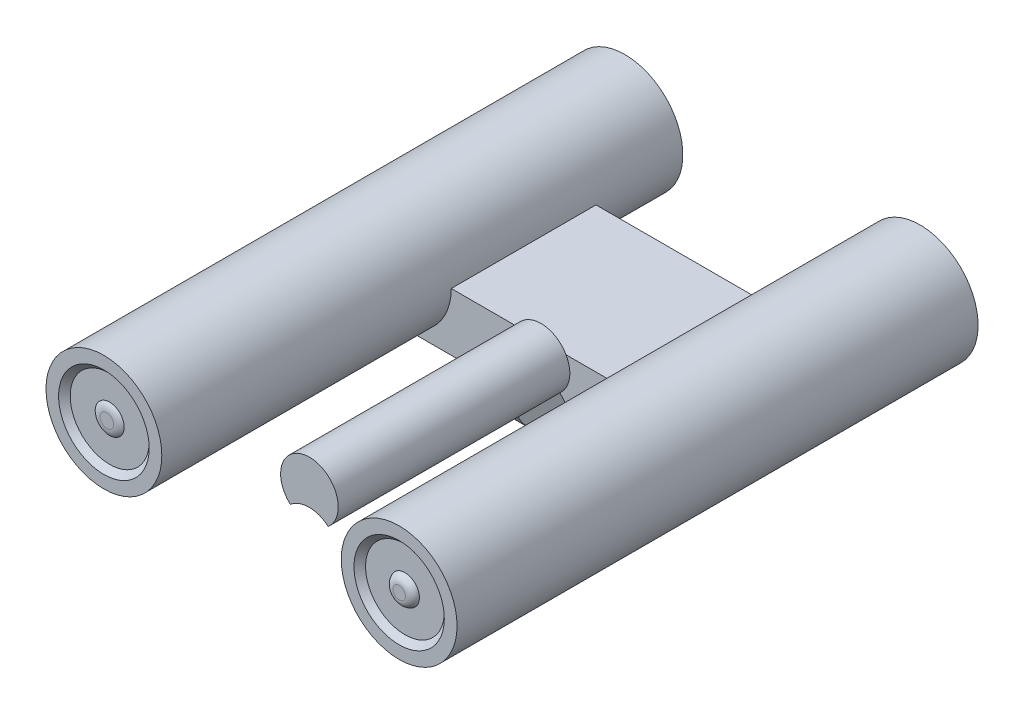
from build123d import *

# Parameters (mm, degrees)
BOSS_EXTRUDE1_DEPTH      = 50
SKETCH4_R                = 5
CUT_EXTRUDE1_DEPTH       = 116.323487875
FILLET2_R                = 20
SKETCH6_R                = 20
BOSS_EXTRUDE4_DEPTH      = 100
BOSS_EXTRUDE5_START      = 30
SKETCH7_R                = 20
BOSS_EXTRUDE5_DEPTH      = 30
SKETCH8_R                = 9.954491404
BOSS_EXTRUDE8_DEPTH      = 80
CUT_EXTRUDE2_DEPTH       = 130.001408198
CUT_EXTRUDE2_DEPTH_BACK  = 130.001408198
SKETCH9_R                = 13.643836255
CUT_EXTRUDE3_DEPTH       = 2
BOSS_EXTRUDE9_START      = 148
BOSS_EXTRUDE9_OUTLINE_R  = 5
BOSS_EXTRUDE9_DEPTH      = 1
CHAMFER1_SIZE            = 2
SKETCH11_R               = 13.6
CUT_EXTRUDE4_DEPTH       = 2
BOSS_EXTRUDE10_START     = 148
BOSS_EXTRUDE10_OUTLINE_R = 5
BOSS_EXTRUDE10_DEPTH     = 2
FILLET5_R                = 4
FILLET6_R                = 3
CHAMFER3_SIZE            = 2


# Read off the part's stored shape, not the designer's step: Boss-Extrude9, Boss-Extrude10
# Some blends are built 0.0001 mm under size
with BuildPart() as part:
    # Sketch1 → Boss-Extrude1 (new body)
    with BuildSketch(Plane.XY):
        with BuildLine():
            Line((-25.087834251, -19.995458795), (-10.087834251, -19.995458795))
            Line((-10.087834251, -19.995458795), (-10.087834251, 0.004541205))
            Line((-10.087834251, 0.004541205), (9.912165749, 0.004541205))
            Line((9.912165749, 0.004541205), (9.912165749, -19.995458795))
            Line((9.912165749, -19.995458795), (24.912165749, -19.995458795))
            Line((24.912165749, -19.995458795), (24.912165749, 0.004541205))
            Line((24.912165749, 0.004541205), (51, 0.004541205))
            ThreePointArc((51, 0.004541205), (65.142135624, 34.146676829), (31, 20.004541205))
            Line((31, 20.004541205), (-31, 20.004541205))
            ThreePointArc((-31, 20.004541205), (-65.142135624, 34.146676829), (-51, 0.004541205))
            Line((-51, 0.004541205), (-25.087834251, 0.004541205))
            Line((-25.087834251, 0.004541205), (-25.087834251, -19.995458795))
        make_face()
    extrude(amount=BOSS_EXTRUDE1_DEPTH)

    # Sketch4 → Cut-Extrude1 (cut, through all)
    with BuildSketch(Plane(origin=(24.912165749, 0, 0), x_dir=(0, 0, -1), z_dir=(1, 0, 0))):
        with Locations((-25, -9.995458795)):
            Circle(SKETCH4_R)
    extrude(amount=-CUT_EXTRUDE1_DEPTH, mode=Mode.SUBTRACT)

    # Fillet2
    fillet2_edges = [part.edges().sort_by_distance(p)[0] for p in [
        (-17.587834251, -19.995458795, 50),
        (-17.587834251, -19.995458795, 0),
        (17.412165749, -19.995458795, 0),
        (17.412165749, -19.995458795, 50),
    ]]
    fillet(fillet2_edges, radius=FILLET2_R)

    # Sketch6 → Boss-Extrude4 (add)
    with BuildSketch(Plane.XY.offset(50)):
        with Locations((-51, 20.004541205)):
            Circle(SKETCH6_R)
        with Locations(Location((51, 20.004541205, 0), (0, 0, 180))):
            Circle(SKETCH6_R)
    extrude(amount=BOSS_EXTRUDE4_DEPTH)

    # Sketch7 → Boss-Extrude5 (add)
    with BuildSketch(Plane(origin=(0, 0, 0), x_dir=(-1, 0, 0), z_dir=(0, 0, -1)).offset(BOSS_EXTRUDE5_START)):
        with Locations((-51, 20.004541205)):
            Circle(SKETCH7_R)
        with Locations((51, 20.004541205)):
            Circle(SKETCH7_R)
    extrude(amount=-BOSS_EXTRUDE5_DEPTH)

    # Sketch8 → Boss-Extrude8 (add)
    with BuildSketch(Plane.XY.offset(50)):
        with Locations(Location((0, 15.094063168, 0), (0, 0, 150.442767445))):
            Circle(SKETCH8_R)
    extrude(amount=BOSS_EXTRUDE8_DEPTH)

    # Sketch5 → Cut-Extrude2 (cut, two sides: drawn at the far end of the back side and taken through both)
    with BuildSketch(Plane.XY.offset(50).offset(-CUT_EXTRUDE2_DEPTH_BACK)):
        with BuildLine():
            Line((-10.087834251, 0.004541205), (9.912165749, 0.004541205))
            ThreePointArc((9.912165749, 0.004541205), (-0.087834251, 10.004541205), (-10.087834251, 0.004541205))
        make_face()
    extrude(amount=CUT_EXTRUDE2_DEPTH + CUT_EXTRUDE2_DEPTH_BACK, mode=Mode.SUBTRACT)

    # Sketch9 → Cut-Extrude3 (cut)
    with BuildSketch(Plane.XY.offset(150)):
        with Locations((-51, 20.004541205)):
            Circle(SKETCH9_R)
    extrude(amount=-CUT_EXTRUDE3_DEPTH, mode=Mode.SUBTRACT)

    # Boss-Extrude9 outline → Boss-Extrude9 (add)
    with BuildSketch(Plane.XY.offset(BOSS_EXTRUDE9_START)):
        with Locations((-51, 20.004541205)):
            Circle(BOSS_EXTRUDE9_OUTLINE_R)
    extrude(amount=BOSS_EXTRUDE9_DEPTH)

    # Chamfer1
    chamfer1_edges = [part.edges().sort_by_distance(p)[0] for p in [
        (-64.643836255, 20.004541205, 150),
    ]]
    chamfer(chamfer1_edges, length=CHAMFER1_SIZE - 0.0001)  # a hair under: the kernel refuses the full size

    # Sketch11 → Cut-Extrude4 (cut)
    with BuildSketch(Plane.XY.offset(150)):
        with Locations((51, 20.004541205)):
            Circle(SKETCH11_R)
    extrude(amount=-CUT_EXTRUDE4_DEPTH, mode=Mode.SUBTRACT)

    # Boss-Extrude10 outline → Boss-Extrude10 (add)
    with BuildSketch(Plane.XY.offset(BOSS_EXTRUDE10_START)):
        with Locations((51, 20.004541205)):
            Circle(BOSS_EXTRUDE10_OUTLINE_R)
    extrude(amount=BOSS_EXTRUDE10_DEPTH)

    # Fillet5
    # the kernel refuses this fillet: 4 mm, written as the material it takes off along each edge
    with BuildSketch(Plane(origin=(-51, 20.004541205, 149), x_dir=(1, 0, 0), z_dir=(0, -1, 0))) as fillet5_piece_1:
        with BuildLine():
            CenterArc((2.354248689, -4), FILLET5_R, 48.590377891, 41.409622109)
            Line((2.354248689, 0), (2.354248689, 0.08))
            Line((2.354248689, 0.08), (5, 0.08))
            Line((5, 0.08), (5.08, 0))
            ThreePointArc((5.08, 0), (5.08, -0.5), (5.052915026, -0.94))
            Line((5.052915026, -0.94), (5, -1))
        make_face()
    revolve(axis=Axis((-51, 20.004541205, 149), (0, 0, 1)), mode=Mode.SUBTRACT)

    # Fillet6
    # the kernel refuses this fillet: 3 mm, written as the material it takes off along each edge
    with BuildSketch(Plane(origin=(51, 20.004541205, 150), x_dir=(1, 0, 0), z_dir=(0, -1, 0))) as fillet6_piece_1:
        with BuildLine():
            CenterArc((2.171572875, -3), FILLET6_R, 19.471220634, 70.528779366)
            Line((2.171572875, 0), (2.171572875, 0.06))
            Line((2.171572875, 0.06), (5, 0.06))
            Line((5, 0.06), (5.06, 0))
            ThreePointArc((5.06, 0), (5.06, -1), (5.056568542, -1.98))
            Line((5.056568542, -1.98), (5, -2))
        make_face()
    revolve(axis=Axis((51, 20.004541205, 150), (0, 0, 1)), mode=Mode.SUBTRACT)

    # Chamfer3
    chamfer3_edges = [part.edges().sort_by_distance(p)[0] for p in [
        (37.4, 20.004541205, 150),
    ]]
    chamfer(chamfer3_edges, length=CHAMFER3_SIZE - 0.0001)  # a hair under: the kernel refuses the full size


solid = part.part
